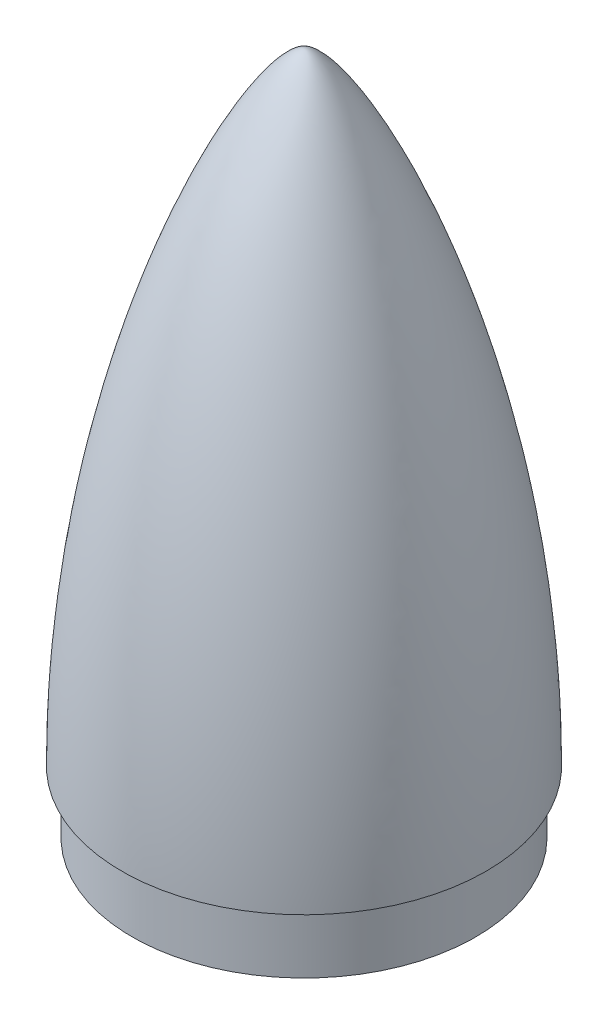
from build123d import *


with BuildPart() as part:
    # Sketch1 → Revolve1 (revolve)
    with BuildSketch(Plane.XY):
        with BuildLine():
            Line((41.5, 0), (44, 0))
            add(Edge.make_bspline(
                [(0, 150), (9.014979846, 150), (44, 84.407059953), (44, 0)],
                knots=[0, 0, 0, 0, 1, 1, 1, 1], degree=3))
            Line((0, 150), (0, 148.75))
            add(Edge.make_bspline(
                [(0, 148.75), (0.06239056, 148.75), (0.161743714, 148.739451329), (0.553973413, 148.630839322), (1.237514939, 148.274478014), (2.294281092, 147.453869912), (3.515158737, 146.254254098), (4.869505468, 144.690429147), (6.822941266, 142.138302248), (9.499352835, 138.103007179), (12.977615857, 131.992355554), (17.844010447, 122.253564223), (24.126426873, 107.276162171), (30.07944231, 89.023648), (34.291265548, 72.73001568), (37.086864573, 59.732316722), (39.431337241, 46.024275958), (41.236927587, 31.67713195), (42.219521942, 19.234766651), (42.635628651, 9.351465349), (42.726851303, 4.415615123), (42.743022792, 2.06245776), (42.743432753, 2)],
                knots=[0, 0, 0, 0, 0.015547466, 0.031094932, 0.062189864, 0.093284797, 0.124379729, 0.155474661, 0.186569593, 0.248759458, 0.310949322, 0.373139186, 0.497518915, 0.621898644, 0.684088508, 0.746278373, 0.808468237, 0.870658102, 0.932847966, 0.963942898, 0.991309547, 0.992055204, 0.992055204, 0.992055204, 0.992055204], degree=3))
            Line((42.743432753, 2), (38, 2))
            Line((38, 2), (38, -15))
            Line((38, -15), (41.5, -15))
            Line((41.5, -15), (41.5, 0))
        make_face()
    revolve(axis=Axis((0, 0, 0), (0, 1, 0)))


solid = part.part
